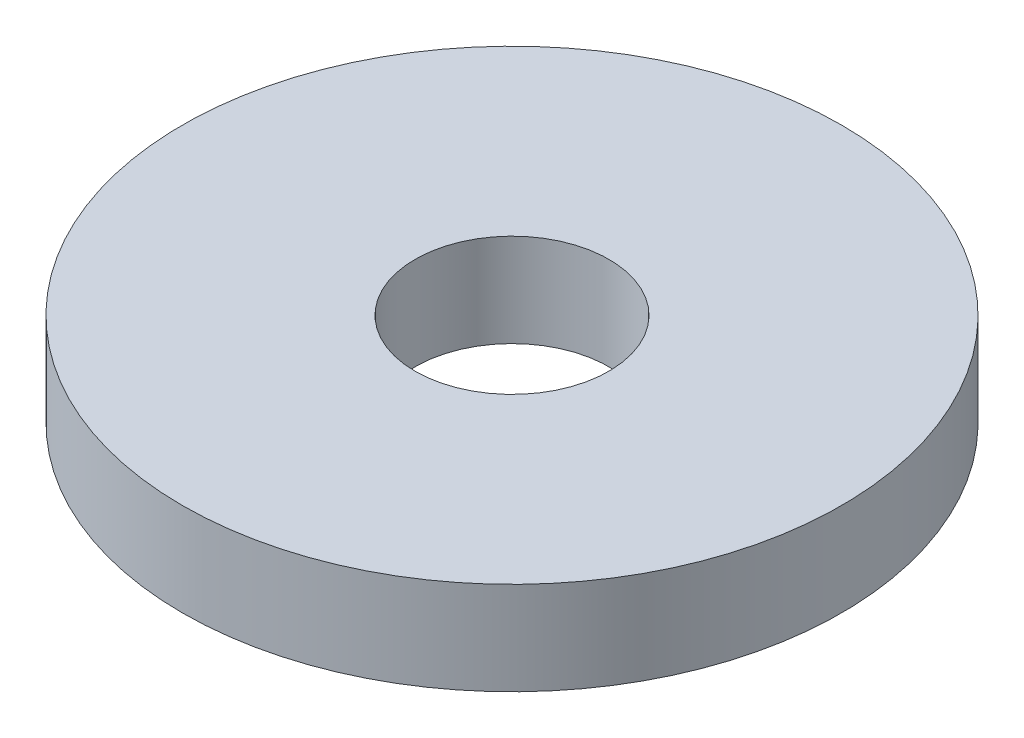
from build123d import *

# Parameters (mm, degrees)
SKETCH1_R           = 85
BOSS_EXTRUDE1_DEPTH = 24
SKETCH2_R           = 25
CUT_EXTRUDE1_DEPTH  = 123.580585739


with BuildPart() as part:
    # Sketch1 → Boss-Extrude1 (new body)
    with BuildSketch(Plane(origin=(0, 0, 0), x_dir=(1, 0, 0), z_dir=(0, 1, 0))):
        Circle(SKETCH1_R)
    extrude(amount=BOSS_EXTRUDE1_DEPTH)

    # Sketch2 → Cut-Extrude1 (cut, through all)
    with BuildSketch(Plane(origin=(0, 0, 0), x_dir=(1, 0, 0), z_dir=(0, 1, 0))):
        Circle(SKETCH2_R)
    extrude(amount=CUT_EXTRUDE1_DEPTH, mode=Mode.SUBTRACT)


solid = part.part
